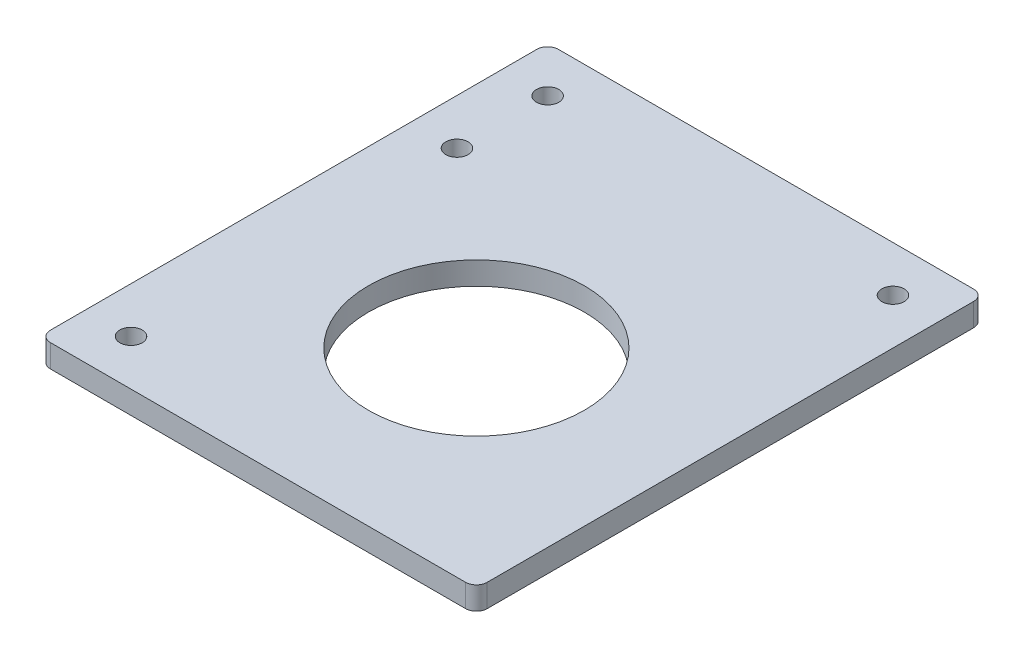
from build123d import *

# Parameters (mm, degrees)
SKETCH1_W           = 121.4
SKETCH1_H           = 141.2
SKETCH1_R           = 30
SKETCH1_R_2         = 3.1
BOSS_EXTRUDE1_DEPTH = 6.35
FILLET1_R           = 3


with BuildPart() as part:
    # Sketch1 → Boss-Extrude1 (new body)
    with BuildSketch(Plane(origin=(0, 0, 0), x_dir=(1, 0, 0), z_dir=(0, 1, 0))):
        with Locations((66.35857699, -35.42087878)):
            Rectangle(SKETCH1_W, SKETCH1_H)
        with Locations((69.15857699, -48.12087878)):
            Circle(SKETCH1_R, mode=Mode.SUBTRACT)
        with Locations((18.35857699, 22.47912122)):
            Circle(SKETCH1_R_2, mode=Mode.SUBTRACT)
        with Locations((114.35857699, 22.47912122)):
            Circle(SKETCH1_R_2, mode=Mode.SUBTRACT)
        with Locations((18.35857699, -93.32087878)):
            Circle(SKETCH1_R_2, mode=Mode.SUBTRACT)
        with Locations((18.35857699, -2.72087878)):
            Circle(SKETCH1_R_2, mode=Mode.SUBTRACT)
    extrude(amount=BOSS_EXTRUDE1_DEPTH)

    # Fillet1
    fillet1_edges = [part.edges().sort_by_distance(p)[0] for p in [
        (127.05857699, 3.175, -35.17912122),
        (127.05857699, 3.175, 106.02087878),
        (5.65857699, 3.175, 106.02087878),
        (5.65857699, 3.175, -35.17912122),
    ]]
    fillet(fillet1_edges, radius=FILLET1_R)


solid = part.part
